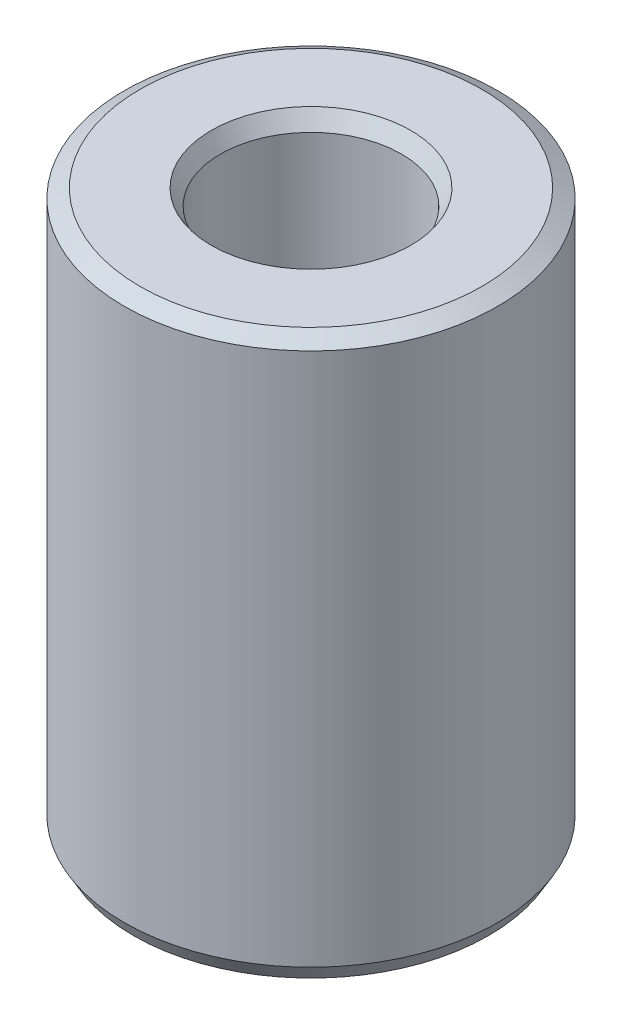
from build123d import *
from OCP.BRepFilletAPI import BRepFilletAPI_MakeChamfer

# Parameters (mm, degrees)
SKETCH1_R           = 7.5
BOSS_EXTRUDE1_DEPTH = 22.437057754
SKETCH2_R           = 3.633854911
CUT_EXTRUDE1_DEPTH  = 25.817767037
CHAMFER1_SIZE       = 0.368738831
CHAMFER1_SIZE2      = 0.63867439


with BuildPart() as part:
    # Sketch1 → Boss-Extrude1 (new body)
    with BuildSketch(Plane(origin=(0, 0, 0), x_dir=(1, 0, 0), z_dir=(0, 1, 0))):
        Circle(SKETCH1_R)
    extrude(amount=BOSS_EXTRUDE1_DEPTH)

    # Sketch2 → Cut-Extrude1 (cut, through all)
    with BuildSketch(Plane(origin=(0, 0, 0), x_dir=(1, 0, 0), z_dir=(0, 1, 0))):
        Circle(SKETCH2_R)
    extrude(amount=CUT_EXTRUDE1_DEPTH, mode=Mode.SUBTRACT)

    # Chamfer1: one chamfer whose edges measure the first distance from different faces: ONE call of the kernel's chamfer builder (chamfer() names one face for all edges)
    chamfer1_edges_1 = [part.edges().sort_by_distance(p)[0] for p in [
        (-3.633854911, 22.437057754, 0),
    ]]
    chamfer1_side_1 = [part.faces().sort_by_distance(p)[0] for p in [
        (-7.287867966, 22.437057754, 0),
    ]]
    chamfer1_edges_2 = [part.edges().sort_by_distance(p)[0] for p in [
        (-3.633854911, 0, 0),
    ]]
    chamfer1_side_2 = [part.faces().sort_by_distance(p)[0] for p in [
        (-3.633854911, 11.218528877, 0),
    ]]
    chamfer1_edges_3 = [part.edges().sort_by_distance(p)[0] for p in [
        (-7.5, 0, 0),
    ]]
    chamfer1_side_3 = [part.faces().sort_by_distance(p)[0] for p in [
        (-7.287867966, 0, 0),
    ]]
    chamfer1_edges_4 = [part.edges().sort_by_distance(p)[0] for p in [
        (-7.5, 22.437057754, 0),
    ]]
    chamfer1_side_4 = [part.faces().sort_by_distance(p)[0] for p in [
        (-7.5, 11.218528877, 0),
    ]]
    chamfer1 = BRepFilletAPI_MakeChamfer(part.part.solid().wrapped)
    for e in chamfer1_edges_1:
        chamfer1.Add(CHAMFER1_SIZE, CHAMFER1_SIZE2, e.wrapped, chamfer1_side_1[0].wrapped)  # the first distance lies on this face
    for e in chamfer1_edges_2:
        chamfer1.Add(CHAMFER1_SIZE, CHAMFER1_SIZE2, e.wrapped, chamfer1_side_2[0].wrapped)  # the first distance lies on this face
    for e in chamfer1_edges_3:
        chamfer1.Add(CHAMFER1_SIZE, CHAMFER1_SIZE2, e.wrapped, chamfer1_side_3[0].wrapped)  # the first distance lies on this face
    for e in chamfer1_edges_4:
        chamfer1.Add(CHAMFER1_SIZE, CHAMFER1_SIZE2, e.wrapped, chamfer1_side_4[0].wrapped)  # the first distance lies on this face
    add(Compound.cast(chamfer1.Shape()), mode=Mode.REPLACE)


solid = part.part
